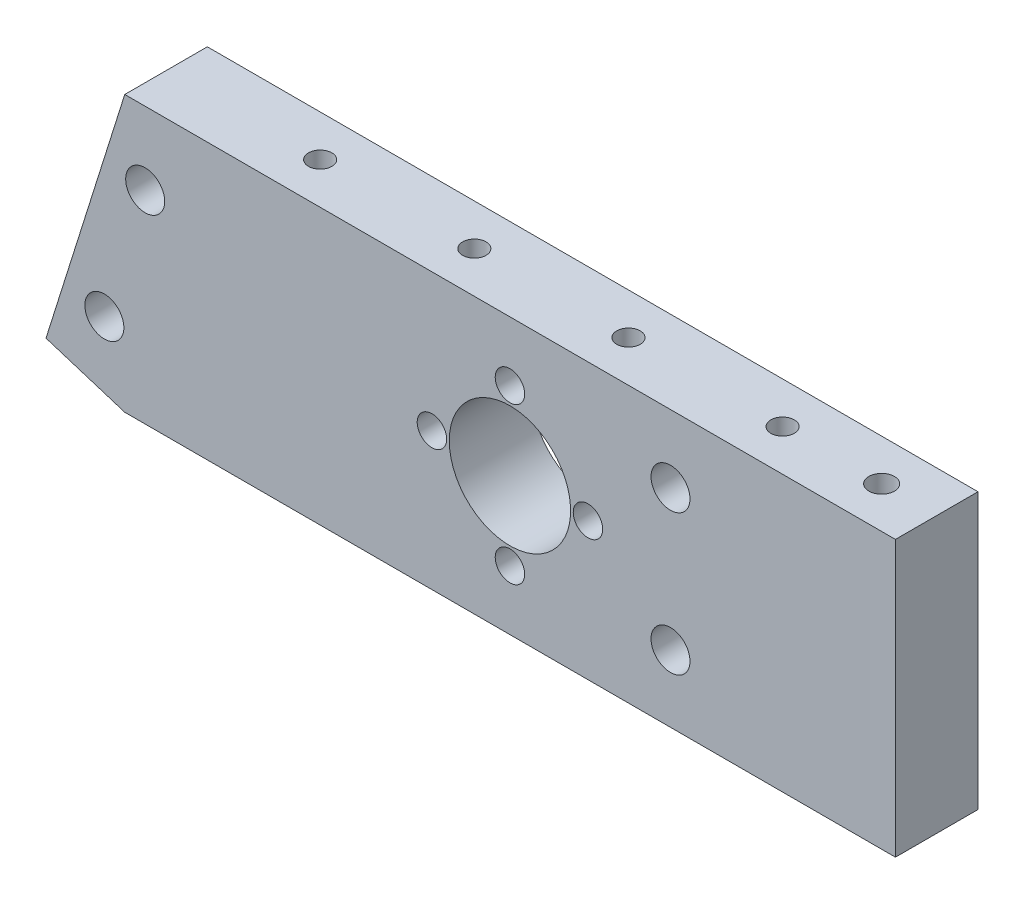
from build123d import *

# Parameters (mm, degrees)
SKETCH1_R           = 2.2479
SKETCH1_R_2         = 2.25
SKETCH1_R_3         = 1.7
SKETCH1_R_4         = 7
BOSS_EXTRUDE1_DEPTH = 9.525
LPATTERN1_COUNT     = 4
LPATTERN1_PITCH     = 17.78
SKETCH13_R          = 1.4732
CUT_EXTRUDE1_DEPTH  = 12.7


with BuildPart() as part:
    # Sketch1 → Boss-Extrude1 (new body)
    with BuildSketch(Plane.XY):
        Polygon((-44.432958233, 15.875), (44.467041767, 15.875), (44.467041767, -15.875), (-44.432958233, -15.875), (-53.519229126, -13.0175), align=None)
        with Locations((18.521420092, 8.060647)):
            Circle(SKETCH1_R, mode=Mode.SUBTRACT)
        with Locations((18.521109153, -8.149574605)):
            Circle(SKETCH1_R, mode=Mode.SUBTRACT)
        with Locations((-42.079822786, 7.48249383)):
            Circle(SKETCH1_R_2, mode=Mode.SUBTRACT)
        with Locations((-46.78609368, -7.48249383)):
            Circle(SKETCH1_R_2, mode=Mode.SUBTRACT)
        with Locations((0, -9)):
            Circle(SKETCH1_R_3, mode=Mode.SUBTRACT)
        with Locations((-9, 0)):
            Circle(SKETCH1_R_3, mode=Mode.SUBTRACT)
        with Locations((0, 9)):
            Circle(SKETCH1_R_3, mode=Mode.SUBTRACT)
        with Locations((9, 0)):
            Circle(SKETCH1_R_3, mode=Mode.SUBTRACT)
        Circle(SKETCH1_R_4, mode=Mode.SUBTRACT)
    extrude(amount=BOSS_EXTRUDE1_DEPTH)

    # Sketch12 → Tap Drill for #6-32 Tap1 (revolve, cut)
    with BuildSketch(Plane(origin=(26.687041767, -15.875, 4.7625), x_dir=(0, 0, -1), z_dir=(1, 0, 0))):
        Polygon((0, 0), (0, 13.51269403), (1.35255, 12.7), (1.35255, 0), align=None)
    tap_drill_for_6_32_tap1 = revolve(axis=Axis((26.687041767, -22.225, 4.7625), (0, 1, 0)), mode=Mode.SUBTRACT)

    # LPattern1: Tap Drill for #6-32 Tap1 ×4
    with Locations(*[(-i * LPATTERN1_PITCH, 0, 0) for i in range(1, LPATTERN1_COUNT)]):
        add(tap_drill_for_6_32_tap1, mode=Mode.SUBTRACT)

    # Mirror8: Tap Drill for #6-32 Tap1 across plane
    add(tap_drill_for_6_32_tap1.mirror(Plane.ZX), mode=Mode.SUBTRACT)

    # Mirror8 copy 1 sketch → Mirror8 copy 1 (revolve, cut)
    with BuildSketch(Plane(origin=(8.907041767, 15.875, 4.7625), x_dir=(0, 0, -1), z_dir=(1, 0, 0))):
        Polygon((0, 0), (0, -13.51269403), (1.35255, -12.7), (1.35255, 0), align=None)
    revolve(axis=Axis((8.907041767, 22.225, 4.7625), (0, 1, 0)), mode=Mode.SUBTRACT)

    # Mirror8 copy 2 sketch → Mirror8 copy 2 (revolve, cut)
    with BuildSketch(Plane(origin=(-8.872958233, 15.875, 4.7625), x_dir=(0, 0, -1), z_dir=(1, 0, 0))):
        Polygon((0, 0), (0, -13.51269403), (1.35255, -12.7), (1.35255, 0), align=None)
    revolve(axis=Axis((-8.872958233, 22.225, 4.7625), (0, 1, 0)), mode=Mode.SUBTRACT)

    # Mirror8 copy 3 sketch → Mirror8 copy 3 (revolve, cut)
    with BuildSketch(Plane(origin=(-26.652958233, 15.875, 4.7625), x_dir=(0, 0, -1), z_dir=(1, 0, 0))):
        Polygon((0, 0), (0, -13.51269403), (1.35255, -12.7), (1.35255, 0), align=None)
    revolve(axis=Axis((-26.652958233, 22.225, 4.7625), (0, 1, 0)), mode=Mode.SUBTRACT)

    # Sketch13 → Cut-Extrude1 (cut)
    with BuildSketch(Plane.XZ.offset(15.875)):
        with Locations((38.117041767, 4.7625)):
            Circle(SKETCH13_R)
    cut_extrude1 = extrude(amount=-CUT_EXTRUDE1_DEPTH, mode=Mode.SUBTRACT)

    # Mirror9: Cut-Extrude1 across plane
    add(cut_extrude1.mirror(Plane.ZX), mode=Mode.SUBTRACT)


solid = part.part
